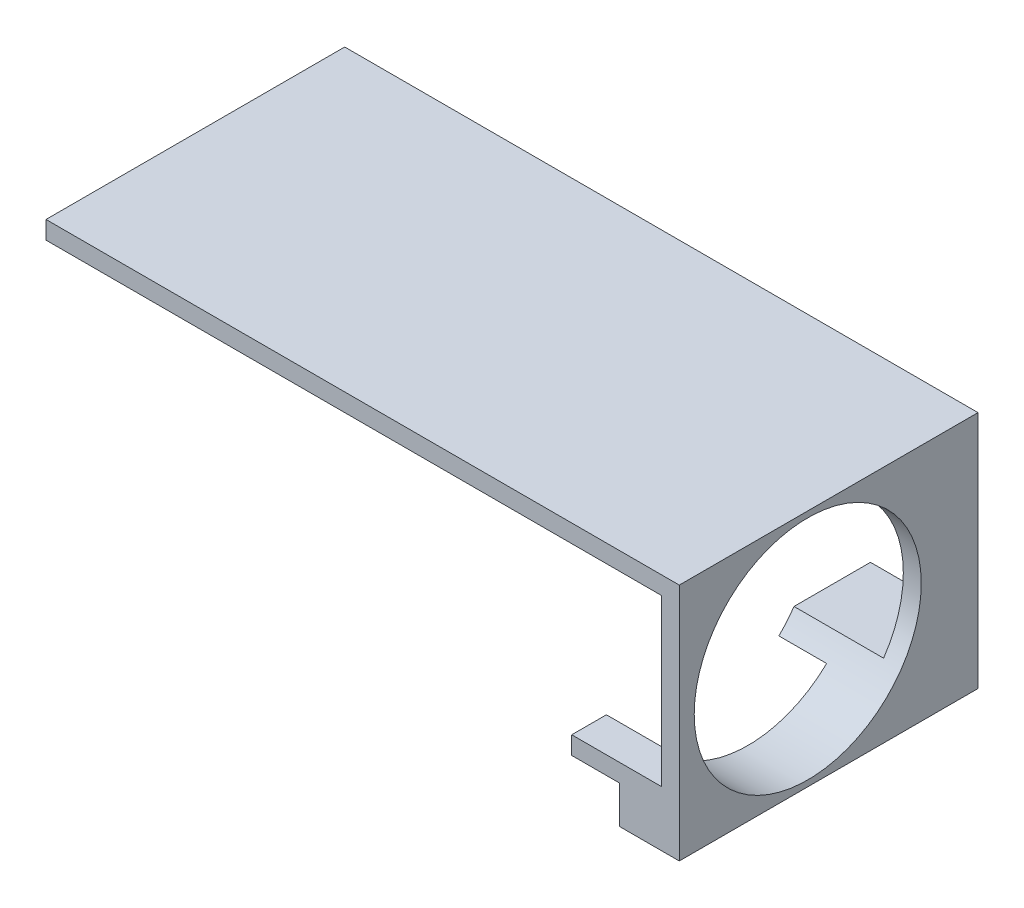
from build123d import *

# Parameters (mm, degrees)
BOSS_EXTRUDE1_DEPTH = 50
CUT_EXTRUDE1_REACH  = 125.839
SKETCH2_R           = 19


with BuildPart() as part:
    # Sketch1 → Boss-Extrude1 (new body)
    with BuildSketch(Plane.XY):
        Polygon((0, 0), (0, 40), (-106, 40), (-106, 37), (-3, 37), (-3, 9.3), (-18, 9.3), (-18, 6.3), (-10, 6.3), (-10, 0), align=None)
    extrude(amount=BOSS_EXTRUDE1_DEPTH)

    # Sketch2 → Cut-Extrude1 (cut, up to next)
    with BuildSketch(Plane(origin=(0, 0, 0), x_dir=(0, 0, -1), z_dir=(1, 0, 0)), mode=Mode.PRIVATE) as cut_extrude1_sk1:
        with Locations((-28.5, 20)):
            Circle(SKETCH2_R)
    cut_extrude1_tool1 = extrude(cut_extrude1_sk1.sketch, amount=-CUT_EXTRUDE1_REACH, mode=Mode.PRIVATE) & part.part
    add(cut_extrude1_tool1.solids().sort_by_distance((0, 20, 28.5))[0], mode=Mode.SUBTRACT)


solid = part.part
